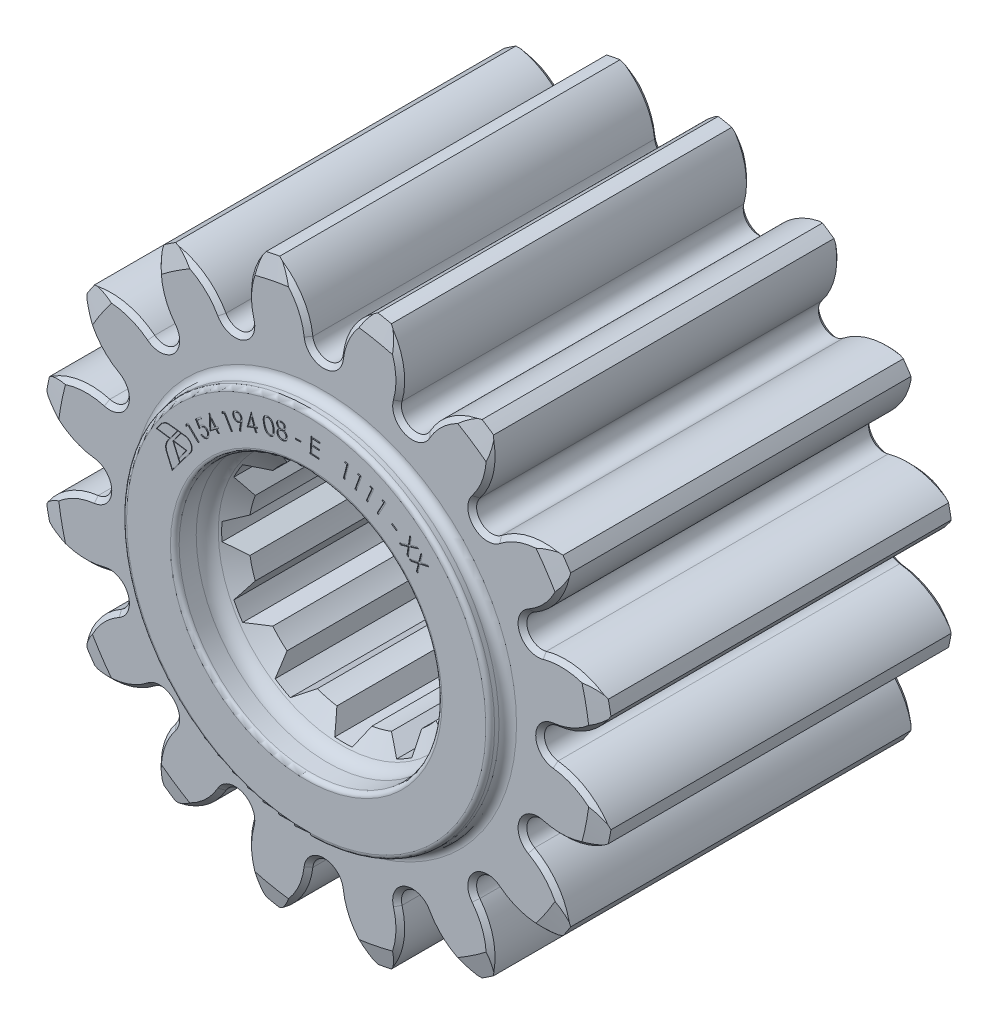
from build123d import *

# Parameters (mm, degrees)
CUT_EXTRUDE1_DEPTH = 64.806827682
CIRPATTERN1_COUNT  = 16
CUT_EXTRUDE2_DEPTH = 64.313436739
CIRPATTERN2_COUNT  = 12
CHAMFER1_SIZE      = 0.5
CHAMFER2_SIZE      = 0.5
PARTNO_START       = -0.1
PARTNO_DEPTH       = 0.1


# Read off the part's stored shape, not the designer's step: PARTNO
with BuildPart() as part:
    # Sketch2 → Revolve1 (revolve)
    with BuildSketch(Plane(origin=(0, 0, 0), x_dir=(0, 0, -1), z_dir=(1, 0, 0)), mode=Mode.PRIVATE) as revolve1_sk:
        with BuildLine():
            Line((0, 15.5), (0, 20.5))
            ThreePointArc((0, 20.5), (-0.146446609, 20.853553391), (-0.5, 21))
            Line((-0.5, 21), (-1, 21))
            ThreePointArc((-1, 21), (-1.707106781, 21.292893219), (-2, 22))
            Line((-2, 22), (-2, 30.5))
            Line((-2, 30.5), (-2.582789494, 32.675))
            Line((-2.582789494, 32.675), (-41.417210506, 32.675))
            Line((-41.417210506, 32.675), (-42, 30.5))
            Line((-42, 30.5), (-42, 22))
            ThreePointArc((-42, 22), (-42.292893219, 21.292893219), (-43, 21))
            Line((-43, 21), (-43.5, 21))
            ThreePointArc((-43.5, 21), (-43.853553391, 20.853553391), (-44, 20.5))
            Line((-44, 20.5), (-44, 15.5))
            ThreePointArc((-44, 15.5), (-43.853553391, 15.146446609), (-43.5, 15))
            Line((-43.5, 15), (-41.554291411, 15))
            ThreePointArc((-41.554291411, 15), (-40.621648935, 14.76923091), (-39.904231515, 14.130178011))
            Line((-39.904231515, 14.130178011), (-38.5, 12.08))
            Line((-38.5, 12.08), (-5.5, 12.08))
            Line((-5.5, 12.08), (-4.095768485, 14.130178011))
            ThreePointArc((-4.095768485, 14.130178011), (-3.378351065, 14.76923091), (-2.445708589, 15))
            Line((-2.445708589, 15), (-0.5, 15))
            ThreePointArc((-0.5, 15), (-0.146446609, 15.146446609), (0, 15.5))
        make_face()
    revolve(revolve1_sk.sketch.rotate(Axis((0, 0, 0), (0, 0, 1)), 90), axis=Axis((0, 0, 0), (0, 0, 1)))

    # Sketch3 → Cut-Extrude1 (cut, through all)
    with BuildSketch(Plane.XY):
        with BuildLine():
            ThreePointArc((5.6, 32.191545862), (0, 32.675), (-5.6, 32.191545862))
            ThreePointArc((-5.6, 32.191545862), (-2.972830161, 29.666253516), (-1.738267746, 26.237700112))
            ThreePointArc((-1.738267746, 26.237700112), (0, 24.69), (1.738267746, 26.237700112))
            ThreePointArc((1.738267746, 26.237700112), (2.972830161, 29.666253516), (5.6, 32.191545862))
        make_face()
    cut_extrude1 = extrude(amount=CUT_EXTRUDE1_DEPTH, mode=Mode.SUBTRACT)

    # CirPattern1: Cut-Extrude1 ×16 about axis
    cirpattern1_axis = Axis((0, 0, 0), (0, 0, 1))
    for i in range(1, CIRPATTERN1_COUNT):
        add(cut_extrude1.rotate(cirpattern1_axis, i * 360 / CIRPATTERN1_COUNT), mode=Mode.SUBTRACT)

    # Sketch4 → Cut-Extrude2 (cut, through all)
    with BuildSketch(Plane.XY):
        with BuildLine():
            Line((-1, 13.863982112), (-2, 11.9132867))
            ThreePointArc((-2, 11.9132867), (0, 12.08), (2, 11.9132867))
            Line((2, 11.9132867), (1, 13.863982112))
            ThreePointArc((1, 13.863982112), (0, 13.9), (-1, 13.863982112))
        make_face()
    cut_extrude2 = extrude(amount=CUT_EXTRUDE2_DEPTH, mode=Mode.SUBTRACT)

    # CirPattern2: Cut-Extrude2 ×12 about axis
    cirpattern2_axis = Axis((0, 0, 0), (0, 0, 1))
    for i in range(1, CIRPATTERN2_COUNT):
        add(cut_extrude2.rotate(cirpattern2_axis, i * 360 / CIRPATTERN2_COUNT), mode=Mode.SUBTRACT)

    # Chamfer1
    chamfer1_edges = [part.edges().sort_by_distance(p)[0] for p in [
        (28.390973825, -2.300498522, 2),
        (24.69, 0, 2),
        (28.390973825, 2.300498522, 2),
        (25.349476955, -12.99013881, 2),
        (22.810585658, -9.448453945, 2),
        (27.110202295, -8.739371813, 2),
        (18.448752011, -21.702148221, 2),
        (17.458466427, -17.458466427, 2),
        (21.702148221, -18.448752011, 2),
        (8.739371813, -27.110202295, 2),
        (9.448453945, -22.810585658, 2),
        (12.99013881, -25.349476955, 2),
        (-2.300498522, -28.390973825, 2),
        (0, -24.69, 2),
        (2.300498522, -28.390973825, 2),
        (-12.99013881, -25.349476955, 2),
        (-9.448453945, -22.810585658, 2),
        (-8.739371813, -27.110202295, 2),
        (-21.702148221, -18.448752011, 2),
        (-17.458466427, -17.458466427, 2),
        (-18.448752011, -21.702148221, 2),
        (-27.110202295, -8.739371813, 2),
        (-22.810585658, -9.448453945, 2),
        (-25.349476955, -12.99013881, 2),
        (-28.390973825, 2.300498522, 2),
        (-24.69, 0, 2),
        (-28.390973825, -2.300498522, 2),
        (-25.349476955, 12.99013881, 2),
        (-22.810585658, 9.448453945, 2),
        (-27.110202295, 8.739371813, 2),
        (-18.448752011, 21.702148221, 2),
        (-17.458466427, 17.458466427, 2),
        (-21.702148221, 18.448752011, 2),
        (-8.739371813, 27.110202295, 2),
        (-9.448453945, 22.810585658, 2),
        (-12.99013881, 25.349476955, 2),
        (-2.300498522, 28.390973825, 2),
        (0, 24.69, 2),
        (2.300498522, 28.390973825, 2),
        (8.739371813, 27.110202295, 2),
        (9.448453945, 22.810585658, 2),
        (12.99013881, 25.349476955, 2),
        (25.349476955, 12.99013881, 2),
        (22.810585658, 9.448453945, 2),
        (27.110202295, 8.739371813, 2),
        (18.448752011, 21.702148221, 2),
        (17.458466427, 17.458466427, 2),
        (21.702148221, 18.448752011, 2),
    ]]
    chamfer(chamfer1_edges, length=CHAMFER1_SIZE)

    # Chamfer2
    chamfer2_edges = [part.edges().sort_by_distance(p)[0] for p in [
        (-27.110202295, 8.739371813, 42),
        (-22.810585658, 9.448453945, 42),
        (-25.349476955, 12.99013881, 42),
        (-28.390973825, -2.300498522, 42),
        (-24.69, 0, 42),
        (-28.390973825, 2.300498522, 42),
        (-25.349476955, -12.99013881, 42),
        (-22.810585658, -9.448453945, 42),
        (-27.110202295, -8.739371813, 42),
        (-18.448752011, -21.702148221, 42),
        (-17.458466427, -17.458466427, 42),
        (-21.702148221, -18.448752011, 42),
        (-8.739371813, -27.110202295, 42),
        (-9.448453945, -22.810585658, 42),
        (-12.99013881, -25.349476955, 42),
        (2.300498522, -28.390973825, 42),
        (0, -24.69, 42),
        (-2.300498522, -28.390973825, 42),
        (12.99013881, -25.349476955, 42),
        (9.448453945, -22.810585658, 42),
        (8.739371813, -27.110202295, 42),
        (21.702148221, -18.448752011, 42),
        (17.458466427, -17.458466427, 42),
        (18.448752011, -21.702148221, 42),
        (27.110202295, -8.739371813, 42),
        (22.810585658, -9.448453945, 42),
        (25.349476955, -12.99013881, 42),
        (28.390973825, -2.300498522, 42),
        (24.69, 0, 42),
        (28.390973825, 2.300498522, 42),
        (27.110202295, 8.739371813, 42),
        (22.810585658, 9.448453945, 42),
        (25.349476955, 12.99013881, 42),
        (21.702148221, 18.448752011, 42),
        (17.458466427, 17.458466427, 42),
        (18.448752011, 21.702148221, 42),
        (12.99013881, 25.349476955, 42),
        (9.448453945, 22.810585658, 42),
        (8.739371813, 27.110202295, 42),
        (2.300498522, 28.390973825, 42),
        (0, 24.69, 42),
        (-2.300498522, 28.390973825, 42),
        (-8.739371813, 27.110202295, 42),
        (-9.448453945, 22.810585658, 42),
        (-12.99013881, 25.349476955, 42),
        (-18.448752011, 21.702148221, 42),
        (-17.458466427, 17.458466427, 42),
        (-21.702148221, 18.448752011, 42),
    ]]
    chamfer(chamfer2_edges, length=CHAMFER2_SIZE)

    # PARTNO outline → PARTNO (cut)
    # profile 1 of 18: a face of its own
    with BuildSketch(Plane.XY.offset(44).offset(PARTNO_START)):
        with BuildLine():
            add(Edge.make_bspline(
                [(-12.175499446, 13.4081082), (-12.164531659, 13.424485291), (-12.143365436, 13.456090678), (-12.109222678, 13.499531103), (-12.07480998, 13.538175219), (-12.050094569, 13.560589529), (-12.038119639, 13.571449546)],
                knots=[0, 0, 0, 0, 0.27607696, 0.532788087, 0.773629907, 1, 1, 1, 1], degree=3))
            Line((-12.175499446, 13.4081082), (-12.426821562, 13.836834161))
            Line((-12.426821562, 13.836834161), (-11.942927331, 14.25293993))
            Line((-11.942927331, 14.25293993), (-12.053985023, 14.382026469))
            Line((-12.053985023, 14.382026469), (-12.642446562, 13.876137046))
            Line((-12.642446562, 13.876137046), (-12.188119639, 13.093685123))
            add(Edge.make_bspline(
                [(-11.95951387, 13.416762046), (-11.969626116, 13.407647851), (-11.990290334, 13.389023137), (-12.019601961, 13.35750144), (-12.048736289, 13.322601327), (-12.077528564, 13.283900803), (-12.106062359, 13.241752964), (-12.133768258, 13.195600655), (-12.161479939, 13.146080802), (-12.179104348, 13.111416639), (-12.188119639, 13.093685123)],
                knots=[0, 0, 0, 0, 0.102501639, 0.209460487, 0.323872897, 0.444828954, 0.572641747, 0.70710504, 0.850177497, 1, 1, 1, 1], degree=3))
            add(Edge.make_bspline(
                [(-11.3746581, 13.381786084), (-11.384553522, 13.392800867), (-11.403954406, 13.41439636), (-11.435890602, 13.442806792), (-11.46880677, 13.467640505), (-11.503244222, 13.488326645), (-11.5390419, 13.504945314), (-11.576121481, 13.517718841), (-11.614573659, 13.526391505), (-11.654091781, 13.530973267), (-11.693963788, 13.531817492), (-11.733637699, 13.528184932), (-11.772618221, 13.520101113), (-11.811294649, 13.50825616), (-11.849154475, 13.491349293), (-11.886716284, 13.470649437), (-11.924230598, 13.446266263), (-11.947566805, 13.426752298), (-11.95951387, 13.416762046)],
                knots=[0, 0, 0, 0, 0.067271607, 0.131892169, 0.193967423, 0.254506049, 0.314157769, 0.373084275, 0.432472619, 0.492998914, 0.553663182, 0.613474867, 0.673701959, 0.734366227, 0.79700651, 0.861811637, 0.929253914, 1, 1, 1, 1], degree=3))
            add(Edge.make_bspline(
                [(-11.394850408, 12.745007238), (-11.38402797, 12.754740572), (-11.362734943, 12.7738908), (-11.335329745, 12.806535767), (-11.311288793, 12.840788819), (-11.291373417, 12.877455169), (-11.27547415, 12.916159536), (-11.263576027, 12.957031937), (-11.255130136, 12.999970218), (-11.251458164, 13.044808907), (-11.251313795, 13.090052599), (-11.255526585, 13.134926985), (-11.264890428, 13.178642215), (-11.277512932, 13.221732372), (-11.295724881, 13.263353397), (-11.317232333, 13.30436714), (-11.343688966, 13.344153912), (-11.364217036, 13.369098616), (-11.3746581, 13.381786084)],
                knots=[0, 0, 0, 0, 0.061469935, 0.120941422, 0.179722879, 0.238162895, 0.296953138, 0.35628552, 0.417875061, 0.481639889, 0.546175553, 0.608975351, 0.671760755, 0.734937707, 0.798459095, 0.863473133, 0.930559195, 1, 1, 1, 1], degree=3))
            add(Edge.make_bspline(
                [(-11.881989831, 12.7377957), (-11.868366538, 12.727642623), (-11.842169364, 12.708118568), (-11.800982291, 12.684589301), (-11.760568147, 12.666364973), (-11.719788553, 12.655148588), (-11.678825841, 12.649263318), (-11.637071452, 12.64875956), (-11.594203631, 12.652590529), (-11.550979514, 12.662150569), (-11.508362086, 12.67596147), (-11.467760342, 12.694516183), (-11.429478455, 12.717170045), (-11.406422969, 12.735704154), (-11.394850408, 12.745007238)],
                knots=[0, 0, 0, 0, 0.095842602, 0.184302379, 0.267258033, 0.345462177, 0.422234206, 0.500282163, 0.580701207, 0.66468295, 0.749659434, 0.833168316, 0.916259852, 1, 1, 1, 1], degree=3))
            Line((-11.881989831, 12.7377957), (-12.0215331, 12.617723584))
            add(Edge.make_bspline(
                [(-11.294249446, 12.611593776), (-11.308015613, 12.60030415), (-11.335114379, 12.578080463), (-11.378180397, 12.549227207), (-11.422365142, 12.524736928), (-11.46791536, 12.505451613), (-11.514372494, 12.489912706), (-11.56203899, 12.47969671), (-11.610765894, 12.473316127), (-11.660144878, 12.472132162), (-11.70953756, 12.474756242), (-11.757980378, 12.482616446), (-11.80536022, 12.493975149), (-11.851333202, 12.509985941), (-11.896076831, 12.530251338), (-11.939220379, 12.555458405), (-11.981743929, 12.584090228), (-12.008148186, 12.606409461), (-12.0215331, 12.617723584)],
                knots=[0, 0, 0, 0, 0.06687598, 0.131645697, 0.1945164, 0.256437175, 0.317287692, 0.378334044, 0.439346965, 0.501707715, 0.563696002, 0.624962547, 0.685875062, 0.746586269, 0.807632621, 0.87015838, 0.934180351, 1, 1, 1, 1], degree=3))
            add(Edge.make_bspline(
                [(-11.230427331, 13.496088969), (-11.221168738, 13.484889145), (-11.202748048, 13.462606229), (-11.177567728, 13.427766929), (-11.155059163, 13.391679562), (-11.134860061, 13.354809615), (-11.11760146, 13.316770655), (-11.102603386, 13.277936148), (-11.090468934, 13.238014346), (-11.080764991, 13.197306693), (-11.073500219, 13.156501978), (-11.06923583, 13.115773274), (-11.067301295, 13.075550716), (-11.068420398, 13.035662462), (-11.072306969, 12.996356489), (-11.079405293, 12.957508743), (-11.088545739, 12.918982608), (-11.101015474, 12.881125747), (-11.115609155, 12.843871127), (-11.133567616, 12.807782968), (-11.153516813, 12.77243804), (-11.176711882, 12.73840892), (-11.201581197, 12.704749423), (-11.230139653, 12.672779642), (-11.260605752, 12.641122845), (-11.282923751, 12.621534339), (-11.294249446, 12.611593776)],
                knots=[0, 0, 0, 0, 0.043859955, 0.08726278, 0.129646602, 0.17218545, 0.214075621, 0.255651909, 0.297774004, 0.339928904, 0.381924227, 0.422794725, 0.463473111, 0.503400186, 0.543150463, 0.582581509, 0.622534954, 0.662580555, 0.702804929, 0.743210542, 0.784164706, 0.825223212, 0.867457675, 0.91039697, 0.954529229, 1, 1, 1, 1], degree=3))
            add(Edge.make_bspline(
                [(-12.038119639, 13.571449546), (-12.022605544, 13.584138957), (-11.99221767, 13.60899405), (-11.943410516, 13.640438907), (-11.893647586, 13.666592255), (-11.842437162, 13.687040938), (-11.789797306, 13.701420381), (-11.735928641, 13.710598064), (-11.680693661, 13.71364068), (-11.624752139, 13.711651743), (-11.56913162, 13.703535979), (-11.514646454, 13.690760441), (-11.462232145, 13.671839235), (-11.411776104, 13.64747217), (-11.363241479, 13.617721601), (-11.316642365, 13.58246986), (-11.271636338, 13.542137783), (-11.244331163, 13.511625742), (-11.230427331, 13.496088969)],
                knots=[0, 0, 0, 0, 0.066081998, 0.12943659, 0.191160583, 0.251322211, 0.310969337, 0.370880829, 0.431261617, 0.493168766, 0.555249669, 0.616420898, 0.677505949, 0.73869517, 0.800992266, 0.864995084, 0.931255313, 1, 1, 1, 1], degree=3))
        make_face()
    # profile 2 of 18: a face of its own
    with BuildSketch(Plane.XY.offset(44).offset(PARTNO_START)):
        with BuildLine():
            add(Edge.make_bspline(
                [(-7.491836444, 16.105218555), (-7.504171194, 16.094200651), (-7.528362243, 16.072592213), (-7.566592929, 16.044328881), (-7.604911365, 16.019711208), (-7.631376735, 16.006440581), (-7.644360482, 15.999930094)],
                knots=[0, 0, 0, 0, 0.266591276, 0.522841778, 0.765909118, 1, 1, 1, 1], degree=3))
            Line((-7.491836444, 16.105218555), (-7.621644136, 15.237309901))
            Line((-7.621644136, 15.237309901), (-7.448206636, 15.213151248))
            Line((-7.448206636, 15.213151248), (-7.296764328, 16.175891632))
            add(Edge.make_bspline(
                [(-7.332461444, 16.736228171), (-7.3251544, 16.719045814), (-7.310282301, 16.684074388), (-7.293920496, 16.628205128), (-7.282112794, 16.568821551), (-7.275970476, 16.516880093), (-7.273005407, 16.472921478), (-7.272382667, 16.437309006), (-7.2731001, 16.399422235), (-7.275439863, 16.359277597), (-7.278588056, 16.316701221), (-7.283313801, 16.271735045), (-7.289520246, 16.224514434), (-7.294312123, 16.192351012), (-7.296764328, 16.175891632)],
                knots=[0, 0, 0, 0, 0.09822448, 0.199917286, 0.305763146, 0.416655247, 0.474989103, 0.537641114, 0.604088712, 0.674423104, 0.749300852, 0.828817357, 0.91239862, 1, 1, 1, 1], degree=3))
            add(Edge.make_bspline(
                [(-8.056860482, 17.004136825), (-8.034363535, 17.013656794), (-7.989930637, 17.032459338), (-7.919922698, 17.049558628), (-7.848907148, 17.057715125), (-7.777410563, 17.056027362), (-7.706589169, 17.045969266), (-7.638471633, 17.025454043), (-7.57329409, 16.995981533), (-7.512675712, 16.956844927), (-7.456318489, 16.911261515), (-7.407633767, 16.858234864), (-7.36479725, 16.800505567), (-7.343282909, 16.757739173), (-7.332461444, 16.736228171)],
                knots=[0, 0, 0, 0, 0.085104385, 0.168086566, 0.250367699, 0.333824155, 0.41690056, 0.499150706, 0.581149313, 0.665597345, 0.750207605, 0.833276603, 0.916140056, 1, 1, 1, 1], degree=3))
            add(Edge.make_bspline(
                [(-8.331620097, 16.268559901), (-8.341498358, 16.291772728), (-8.360907385, 16.337381809), (-8.378931654, 16.408676373), (-8.386882711, 16.480236903), (-8.385579521, 16.551692622), (-8.374283069, 16.622152019), (-8.353766672, 16.690613859), (-8.322717136, 16.756004042), (-8.283764683, 16.818404036), (-8.236747268, 16.875996109), (-8.182714163, 16.926465192), (-8.123063851, 16.970480005), (-8.079091305, 16.992835001), (-8.056860482, 17.004136825)],
                knots=[0, 0, 0, 0, 0.086415053, 0.169790233, 0.251085451, 0.33271436, 0.414099392, 0.495073182, 0.576947317, 0.661577455, 0.746811701, 0.831083747, 0.914602462, 1, 1, 1, 1], degree=3))
            add(Edge.make_bspline(
                [(-7.644360482, 15.999930094), (-7.660343733, 15.992997765), (-7.691895387, 15.979313037), (-7.740738314, 15.96461858), (-7.789780304, 15.954985921), (-7.838999447, 15.951280549), (-7.888413259, 15.951755625), (-7.938099753, 15.958033626), (-7.987925521, 15.969728787), (-8.037424417, 15.986235561), (-8.085381896, 16.007304529), (-8.130669982, 16.032645894), (-8.17273165, 16.061836182), (-8.211116026, 16.095471115), (-8.246826568, 16.132535141), (-8.278242229, 16.174478192), (-8.307636024, 16.219444699), (-8.323545353, 16.252024232), (-8.331620097, 16.268559901)],
                knots=[0, 0, 0, 0, 0.063504398, 0.125360524, 0.185634953, 0.245454837, 0.305086453, 0.365610697, 0.427718013, 0.491492731, 0.55568352, 0.618494027, 0.680522374, 0.742057604, 0.804388892, 0.867875128, 0.932940313, 1, 1, 1, 1], degree=3))
        make_face()
        with BuildLine():
            add(Edge.make_bspline(
                [(-8.172605674, 16.342478171), (-8.166928471, 16.331062909), (-8.155710084, 16.308505883), (-8.135394953, 16.27710264), (-8.112635526, 16.248404906), (-8.087129482, 16.222682406), (-8.059353065, 16.199439626), (-8.028761616, 16.179251852), (-7.995893673, 16.161442339), (-7.960793518, 16.14695185), (-7.924673679, 16.135240218), (-7.887993758, 16.127928647), (-7.851588664, 16.123110113), (-7.815321635, 16.123549779), (-7.779281413, 16.126491865), (-7.743471464, 16.13401214), (-7.707648872, 16.144637525), (-7.684535466, 16.154618087), (-7.672846059, 16.159665671)],
                knots=[0, 0, 0, 0, 0.064581688, 0.127616076, 0.189175858, 0.249919277, 0.310918794, 0.372424288, 0.435390923, 0.500110398, 0.564657593, 0.627506225, 0.689471653, 0.750395062, 0.810957957, 0.872490601, 0.935513211, 1, 1, 1, 1], degree=3))
            add(Edge.make_bspline(
                [(-7.989432597, 16.841877209), (-8.000847857, 16.836200006), (-8.023404881, 16.824981618), (-8.054808145, 16.804666491), (-8.083505801, 16.78190705), (-8.109228586, 16.756401058), (-8.132470301, 16.728624447), (-8.152662116, 16.698033733), (-8.170456029, 16.665162952), (-8.185006537, 16.630073717), (-8.196503087, 16.593889487), (-8.204593484, 16.557460912), (-8.208525992, 16.521066731), (-8.208889735, 16.484960158), (-8.205733798, 16.448911946), (-8.19827179, 16.413104011), (-8.187630556, 16.377280871), (-8.177652162, 16.35416754), (-8.172605674, 16.342478171)],
                knots=[0, 0, 0, 0, 0.064616881, 0.127685619, 0.189278948, 0.25005547, 0.311088228, 0.372627238, 0.435628187, 0.500382931, 0.564965301, 0.627975096, 0.689299384, 0.750259041, 0.81085494, 0.872421116, 0.935478069, 1, 1, 1, 1], degree=3))
            add(Edge.make_bspline(
                [(-7.488951828, 16.659785863), (-7.494629056, 16.671201077), (-7.505847493, 16.693758009), (-7.526162264, 16.72516194), (-7.548923014, 16.753857141), (-7.574424193, 16.779588955), (-7.602218846, 16.802796825), (-7.632693919, 16.82308571), (-7.665774287, 16.840365417), (-7.700740236, 16.855028311), (-7.736943246, 16.86648587), (-7.773368017, 16.874597061), (-7.80975929, 16.878485706), (-7.846012261, 16.879004639), (-7.882250141, 16.875230533), (-7.918336186, 16.867983244), (-7.954435601, 16.857245531), (-7.977630784, 16.84705977), (-7.989432597, 16.841877209)],
                knots=[0, 0, 0, 0, 0.064502633, 0.12745986, 0.188944286, 0.249613349, 0.310538195, 0.3719684, 0.434571765, 0.499212016, 0.563680199, 0.626578587, 0.687794448, 0.748646323, 0.809798644, 0.871852521, 0.934797984, 1, 1, 1, 1], degree=3))
            add(Edge.make_bspline(
                [(-7.672846059, 16.159665671), (-7.661278556, 16.165291616), (-7.638455521, 16.176391776), (-7.607197328, 16.197414048), (-7.578063099, 16.219849227), (-7.552314701, 16.245505292), (-7.529157671, 16.273400169), (-7.508406282, 16.303649475), (-7.491209741, 16.336865308), (-7.47651501, 16.371810022), (-7.465066496, 16.408019367), (-7.456925165, 16.444557048), (-7.453051179, 16.481079855), (-7.452662889, 16.517303298), (-7.45582503, 16.553352245), (-7.463285347, 16.589159979), (-7.473927041, 16.624983174), (-7.483905372, 16.648096497), (-7.488951828, 16.659785863)],
                knots=[0, 0, 0, 0, 0.065027298, 0.128300832, 0.19024737, 0.250901956, 0.311812263, 0.373567331, 0.436155757, 0.500780583, 0.565233381, 0.628116759, 0.689922744, 0.750760098, 0.811234422, 0.872677078, 0.93560752, 1, 1, 1, 1], degree=3))
        make_face(mode=Mode.SUBTRACT)
    # profile 3 of 18: a face of its own
    with BuildSketch(Plane.XY.offset(44).offset(PARTNO_START)):
        with BuildLine():
            add(Edge.make_bspline(
                [(-4.020223341, 16.466762631), (-4.034001218, 16.463522551), (-4.061372194, 16.457085845), (-4.102783099, 16.451665523), (-4.143846106, 16.448401444), (-4.184740248, 16.449329521), (-4.22550196, 16.453201032), (-4.26594487, 16.460606154), (-4.306206741, 16.470519083), (-4.345805329, 16.484386947), (-4.384955721, 16.501310569), (-4.423029319, 16.521877846), (-4.460121779, 16.545777063), (-4.495643256, 16.573500323), (-4.531013358, 16.603711255), (-4.564706836, 16.63801089), (-4.597107037, 16.675854236), (-4.629377411, 16.716616973), (-4.659499893, 16.762592802), (-4.689392021, 16.813108254), (-4.717145706, 16.869495105), (-4.744173612, 16.931028086), (-4.770595377, 16.997673732), (-4.795248324, 17.069970364), (-4.819140966, 17.147512089), (-4.833504389, 17.201326868), (-4.840896418, 17.229022247)],
                knots=[0, 0, 0, 0, 0.033690627, 0.066929421, 0.099359523, 0.131713722, 0.164215766, 0.196785818, 0.229557801, 0.262874172, 0.296592761, 0.331047063, 0.365826888, 0.40155632, 0.438290054, 0.476549361, 0.515922393, 0.556923803, 0.600275408, 0.646722673, 0.696652931, 0.749845511, 0.806780522, 0.867347248, 0.931731242, 1, 1, 1, 1], degree=3))
            add(Edge.make_bspline(
                [(-3.652795456, 17.536233785), (-3.646111585, 17.509596723), (-3.633064942, 17.457602268), (-3.61722928, 17.380848649), (-3.605073459, 17.307693095), (-3.595584396, 17.238116444), (-3.590787557, 17.172005129), (-3.588711493, 17.109437197), (-3.590402564, 17.05041148), (-3.595920215, 16.994805691), (-3.604144882, 16.942167749), (-3.615403016, 16.892350827), (-3.629040317, 16.844834253), (-3.645545014, 16.799878128), (-3.664846294, 16.757412413), (-3.686293942, 16.71737817), (-3.710715949, 16.67991511), (-3.737584774, 16.6450351), (-3.76702398, 16.613117147), (-3.797455346, 16.583112859), (-3.830606273, 16.557033945), (-3.864832773, 16.532963866), (-3.901037475, 16.51198637), (-3.939121727, 16.494066794), (-3.978711339, 16.478183818), (-4.006315846, 16.470588997), (-4.020223341, 16.466762631)],
                knots=[0, 0, 0, 0, 0.064916426, 0.126714206, 0.185196305, 0.240210059, 0.292641364, 0.341816635, 0.38815185, 0.432115171, 0.47382931, 0.514016592, 0.552772167, 0.590617157, 0.627112294, 0.662963562, 0.697875911, 0.732714184, 0.766906902, 0.800464501, 0.833611821, 0.866479091, 0.899325476, 0.932369124, 0.965926724, 1, 1, 1, 1], degree=3))
            add(Edge.make_bspline(
                [(-4.492939687, 18.294527055), (-4.478920376, 18.297857585), (-4.45118763, 18.304445981), (-4.409106166, 18.310668164), (-4.367136312, 18.312938471), (-4.325413504, 18.31290221), (-4.283957098, 18.308673603), (-4.242664044, 18.301614161), (-4.201688613, 18.290520714), (-4.160783544, 18.277048799), (-4.120649146, 18.259587124), (-4.081412978, 18.23862477), (-4.042992549, 18.2144115), (-4.005786676, 18.186503949), (-3.96967833, 18.155009849), (-3.934630264, 18.119941061), (-3.900877379, 18.08114043), (-3.867384986, 18.039202893), (-3.835164044, 17.99301395), (-3.805052867, 17.94179138), (-3.775711856, 17.886183037), (-3.748035002, 17.825629636), (-3.722203843, 17.760023042), (-3.697361648, 17.689809256), (-3.673881032, 17.614762368), (-3.659941853, 17.562848966), (-3.652795456, 17.536233785)],
                knots=[0, 0, 0, 0, 0.034020952, 0.067299627, 0.100286484, 0.133214668, 0.165724214, 0.198577682, 0.232038654, 0.265879135, 0.300206589, 0.335254114, 0.370849113, 0.407352666, 0.444976857, 0.483915462, 0.524343359, 0.566368959, 0.610621831, 0.657209209, 0.706600465, 0.759058024, 0.814351122, 0.873065504, 0.93492269, 1, 1, 1, 1], degree=3))
            add(Edge.make_bspline(
                [(-4.840896418, 17.229022247), (-4.847926796, 17.256984663), (-4.861579327, 17.311285831), (-4.878498006, 17.391027677), (-4.891969296, 17.466415788), (-4.90178587, 17.53749862), (-4.908097866, 17.604272128), (-4.910538248, 17.666853454), (-4.910298839, 17.725162922), (-4.905305619, 17.779449446), (-4.897806209, 17.830398086), (-4.88726849, 17.878776144), (-4.874359882, 17.92492254), (-4.858971803, 17.968777949), (-4.840375407, 18.009999388), (-4.819582951, 18.049028874), (-4.79594781, 18.085595584), (-4.770075359, 18.119976286), (-4.741575972, 18.151418202), (-4.711606918, 18.180661626), (-4.679438556, 18.206464083), (-4.645634154, 18.229831586), (-4.61002662, 18.250269697), (-4.57269102, 18.268070227), (-4.533582849, 18.282932136), (-4.506583127, 18.290634774), (-4.492939687, 18.294527055)],
                knots=[0, 0, 0, 0, 0.06859393, 0.133204887, 0.193900276, 0.250761428, 0.303887285, 0.35339919, 0.399728561, 0.442498763, 0.482981325, 0.522187329, 0.560210596, 0.596931946, 0.632645152, 0.667700872, 0.702047275, 0.736134376, 0.769951723, 0.802916827, 0.835652918, 0.867936241, 0.900603565, 0.933220785, 0.966255274, 1, 1, 1, 1], degree=3))
        make_face()
        with BuildLine():
            add(Edge.make_bspline(
                [(-4.443901225, 18.130825131), (-4.462802384, 18.124872607), (-4.500534346, 18.112989714), (-4.55280499, 18.083055899), (-4.600814326, 18.04454803), (-4.635984896, 18.005133466), (-4.661960993, 17.970255404), (-4.678673084, 17.941092355), (-4.69399512, 17.910491043), (-4.706879625, 17.877728725), (-4.718226502, 17.843259691), (-4.726603246, 17.806623145), (-4.733603536, 17.768271155), (-4.738300058, 17.727572167), (-4.740473922, 17.683853153), (-4.739576087, 17.636414393), (-4.73591902, 17.584909478), (-4.729181609, 17.529381323), (-4.72032699, 17.469662157), (-4.707724831, 17.406035658), (-4.69313471, 17.338155761), (-4.681428967, 17.29184817), (-4.67539161, 17.267964555)],
                knots=[0, 0, 0, 0, 0.059376885, 0.118532753, 0.179651138, 0.243544909, 0.27661737, 0.310114695, 0.344343321, 0.379338263, 0.415758575, 0.45323712, 0.492115361, 0.532821302, 0.576198072, 0.623497477, 0.675249714, 0.731225604, 0.791474123, 0.856543284, 0.926010727, 1, 1, 1, 1], degree=3))
            add(Edge.make_bspline(
                [(-3.815055071, 17.490440516), (-3.820654676, 17.511762756), (-3.831623985, 17.553531825), (-3.850551959, 17.613901232), (-3.869963804, 17.671078686), (-3.890308285, 17.724872401), (-3.912436616, 17.774888807), (-3.935100393, 17.821661803), (-3.958905017, 17.865001469), (-3.983663044, 17.904993725), (-4.009479173, 17.941578497), (-4.035644923, 17.975209342), (-4.062749841, 18.005437851), (-4.09015716, 18.03287396), (-4.118682734, 18.056525204), (-4.147596326, 18.077356778), (-4.177367024, 18.094718902), (-4.217066856, 18.113594174), (-4.267134508, 18.130648599), (-4.327293983, 18.14121929), (-4.386734409, 18.142839268), (-4.42487457, 18.134823759), (-4.443901225, 18.130825131)],
                knots=[0, 0, 0, 0, 0.066271714, 0.129822558, 0.190160679, 0.247809349, 0.302662994, 0.354541134, 0.404030912, 0.451260566, 0.495874074, 0.538597682, 0.579290911, 0.617875766, 0.655075246, 0.690571829, 0.724907155, 0.758527644, 0.822635975, 0.883175034, 0.941720532, 1, 1, 1, 1], degree=3))
            add(Edge.make_bspline(
                [(-3.764574302, 17.026378016), (-3.763445327, 17.043557627), (-3.7611497, 17.078490181), (-3.76081587, 17.131943538), (-3.763696066, 17.187248403), (-3.767931718, 17.244470736), (-3.776445218, 17.303417754), (-3.786179117, 17.364246796), (-3.799396448, 17.426847648), (-3.809764776, 17.468955544), (-3.815055071, 17.490440516)],
                knots=[0, 0, 0, 0, 0.110129837, 0.223935019, 0.341705351, 0.464374203, 0.590847291, 0.722569032, 0.858444681, 1, 1, 1, 1], degree=3))
            add(Edge.make_bspline(
                [(-4.054478148, 16.625777055), (-4.035711907, 16.631628929), (-3.998159002, 16.643339047), (-3.946116235, 16.672599785), (-3.898722239, 16.710775357), (-3.863476648, 16.749280519), (-3.838414969, 16.784268238), (-3.821285567, 16.812924043), (-3.806721338, 16.843722759), (-3.793414124, 16.876190288), (-3.783273531, 16.911087334), (-3.774412826, 16.947721809), (-3.768476105, 16.986468257), (-3.765891662, 17.012903342), (-3.764574302, 17.026378016)],
                knots=[0, 0, 0, 0, 0.111153571, 0.222428112, 0.335821258, 0.45489986, 0.516896447, 0.579507338, 0.643785414, 0.709808076, 0.778113588, 0.849484739, 0.923278319, 1, 1, 1, 1], degree=3))
            add(Edge.make_bspline(
                [(-4.67539161, 17.267964555), (-4.669165497, 17.244246471), (-4.657078302, 17.198200876), (-4.637163266, 17.132005875), (-4.617099372, 17.070472496), (-4.596208928, 17.013975333), (-4.575051151, 16.962313437), (-4.553340218, 16.91565952), (-4.531606683, 16.873656919), (-4.508643665, 16.836542881), (-4.484887914, 16.803285958), (-4.460304711, 16.77307369), (-4.435199958, 16.744952277), (-4.40847588, 16.720341024), (-4.381113808, 16.697924939), (-4.352825509, 16.678210646), (-4.323473186, 16.661035819), (-4.283493516, 16.642705172), (-4.233164701, 16.625641015), (-4.172404312, 16.614868311), (-4.112370418, 16.613888385), (-4.073745877, 16.621820263), (-4.054478148, 16.625777055)],
                knots=[0, 0, 0, 0, 0.073655279, 0.14299221, 0.207614511, 0.268043188, 0.32389466, 0.375261076, 0.422580225, 0.465865182, 0.506241107, 0.545260876, 0.582832283, 0.619362279, 0.654266356, 0.689020727, 0.72283212, 0.756269403, 0.821005574, 0.881847017, 0.941059762, 1, 1, 1, 1], degree=3))
        make_face(mode=Mode.SUBTRACT)
    # profile 4 of 18: a face of its own
    with BuildSketch(Plane.XY.offset(44).offset(PARTNO_START)):
        with BuildLine():
            add(Edge.make_bspline(
                [(-2.335939336, 18.186443105), (-2.333909389, 18.166753913), (-2.329924254, 18.128100649), (-2.334090819, 18.070388052), (-2.34686095, 18.014973171), (-2.36808312, 17.961758188), (-2.397720649, 17.910842155), (-2.435849332, 17.8621757), (-2.482162851, 17.815536015), (-2.517707528, 17.787630032), (-2.536059528, 17.773221951)],
                knots=[0, 0, 0, 0, 0.122443532, 0.240377676, 0.356521103, 0.473499343, 0.593936273, 0.720240397, 0.855557883, 1, 1, 1, 1], degree=3))
            add(Edge.make_bspline(
                [(-2.910698951, 18.582356566), (-2.887890259, 18.584709873), (-2.84280656, 18.589361421), (-2.775023439, 18.586674781), (-2.708760873, 18.575445478), (-2.644612071, 18.555894801), (-2.583992291, 18.529126071), (-2.528285133, 18.495394344), (-2.478251108, 18.454923196), (-2.434689052, 18.408195353), (-2.397466939, 18.357158219), (-2.368037562, 18.302922881), (-2.346801571, 18.245823757), (-2.339571676, 18.206300039), (-2.335939336, 18.186443105)],
                knots=[0, 0, 0, 0, 0.088789013, 0.175500513, 0.261967639, 0.348622807, 0.434757986, 0.518169235, 0.60031152, 0.683365546, 0.765087988, 0.844504661, 0.92187828, 1, 1, 1, 1], degree=3))
            add(Edge.make_bspline(
                [(-3.371155682, 18.045457528), (-3.372962909, 18.064796942), (-3.376603018, 18.1037503), (-3.370944931, 18.163099816), (-3.356984191, 18.222817589), (-3.334734886, 18.282285871), (-3.30433912, 18.339598643), (-3.266132835, 18.392845822), (-3.220174168, 18.440793233), (-3.167183618, 18.483121672), (-3.108704636, 18.51917969), (-3.046247304, 18.548861846), (-2.979892149, 18.570371841), (-2.933899607, 18.578338057), (-2.910698951, 18.582356566)],
                knots=[0, 0, 0, 0, 0.074256899, 0.149567904, 0.227063093, 0.308634818, 0.392036956, 0.474821935, 0.558825349, 0.645599576, 0.733871305, 0.821389617, 0.909901086, 1, 1, 1, 1], degree=3))
            add(Edge.make_bspline(
                [(-3.057093182, 17.700024836), (-3.079311132, 17.708659855), (-3.122406262, 17.725408803), (-3.181485947, 17.758002017), (-3.233169002, 17.795794954), (-3.276868373, 17.838789742), (-3.31288293, 17.885772816), (-3.340538931, 17.936303386), (-3.360985781, 17.989546162), (-3.367761809, 18.026798931), (-3.371155682, 18.045457528)],
                knots=[0, 0, 0, 0, 0.145203544, 0.281644599, 0.410031993, 0.534393431, 0.654133134, 0.769578181, 0.884589844, 1, 1, 1, 1], degree=3))
            add(Edge.make_bspline(
                [(-3.334737413, 17.172861374), (-3.337183281, 17.19712124), (-3.342003612, 17.244932719), (-3.335943269, 17.316413092), (-3.320710784, 17.385716816), (-3.298258352, 17.440949639), (-3.275499677, 17.484054923), (-3.254487605, 17.516058024), (-3.230024912, 17.547653042), (-3.202261533, 17.579033571), (-3.170787697, 17.609936952), (-3.136082929, 17.640569121), (-3.098163301, 17.671046303), (-3.071024148, 17.69019533), (-3.057093182, 17.700024836)],
                knots=[0, 0, 0, 0, 0.115576701, 0.227779204, 0.338972482, 0.45143167, 0.50965252, 0.570288325, 0.632966451, 0.699281651, 0.76910758, 0.842296019, 0.919047999, 1, 1, 1, 1], degree=3))
            add(Edge.make_bspline(
                [(-2.66117972, 16.718173874), (-2.685063278, 16.715213508), (-2.731390681, 16.709471229), (-2.799703513, 16.708276289), (-2.864336145, 16.712182195), (-2.925177913, 16.722817906), (-2.982500153, 16.738553216), (-3.035989687, 16.760638549), (-3.085999198, 16.788556205), (-3.131328486, 16.822548724), (-3.172471885, 16.860087208), (-3.209882758, 16.899181892), (-3.242129223, 16.94065744), (-3.26988036, 16.983659303), (-3.293853904, 17.028148905), (-3.311870589, 17.074929764), (-3.326478093, 17.123075659), (-3.33197231, 17.156193822), (-3.334737413, 17.172861374)],
                knots=[0, 0, 0, 0, 0.079263085, 0.153748153, 0.224810549, 0.292340783, 0.356925747, 0.420333889, 0.482584553, 0.545170795, 0.606587902, 0.665990825, 0.72327871, 0.779422673, 0.834528618, 0.889474886, 0.944375445, 1, 1, 1, 1], degree=3))
            add(Edge.make_bspline(
                [(-2.218751836, 16.975625797), (-2.230695473, 16.958215132), (-2.254345975, 16.923738954), (-2.297407553, 16.878199924), (-2.344672724, 16.837288452), (-2.398027901, 16.802658649), (-2.456262762, 16.772997079), (-2.519868985, 16.748874087), (-2.588574008, 16.729969318), (-2.63656864, 16.722172163), (-2.66117972, 16.718173874)],
                knots=[0, 0, 0, 0, 0.119592445, 0.236814077, 0.354312924, 0.473436151, 0.596612453, 0.724361885, 0.858656028, 1, 1, 1, 1], degree=3))
            add(Edge.make_bspline(
                [(-2.135819144, 17.356395028), (-2.133844448, 17.339471904), (-2.129946328, 17.306065037), (-2.129225526, 17.255944701), (-2.13339412, 17.206880719), (-2.141127147, 17.158528362), (-2.153922922, 17.111257081), (-2.170947192, 17.064759299), (-2.192587775, 17.019324915), (-2.209979737, 16.990276923), (-2.218751836, 16.975625797)],
                knots=[0, 0, 0, 0, 0.12828871, 0.253246611, 0.376782708, 0.4988368, 0.621604086, 0.74506053, 0.871414506, 1, 1, 1, 1], degree=3))
            add(Edge.make_bspline(
                [(-2.536059528, 17.773221951), (-2.52050258, 17.7678353), (-2.490222159, 17.757350593), (-2.446735094, 17.739625106), (-2.406433326, 17.720564012), (-2.369022181, 17.700365517), (-2.334822866, 17.67878251), (-2.303538029, 17.65598462), (-2.275418956, 17.631896018), (-2.250245744, 17.6064077), (-2.227967764, 17.579561854), (-2.207507334, 17.551830333), (-2.189976367, 17.522459607), (-2.174230167, 17.4919559), (-2.160954427, 17.459998117), (-2.150187607, 17.426558039), (-2.141342224, 17.392028369), (-2.137669346, 17.368332007), (-2.135819144, 17.356395028)],
                knots=[0, 0, 0, 0, 0.080508247, 0.156703207, 0.229540753, 0.298458497, 0.364508733, 0.427176381, 0.487621022, 0.545399982, 0.602150082, 0.658118443, 0.713767928, 0.76924016, 0.825898851, 0.882782753, 0.940952126, 1, 1, 1, 1], degree=3))
        make_face()
        with BuildLine():
            add(Edge.make_bspline(
                [(-2.312501836, 17.327909451), (-2.314666146, 17.340101427), (-2.318938504, 17.36416844), (-2.329501974, 17.399197029), (-2.343992421, 17.432423551), (-2.362223157, 17.464044552), (-2.384018528, 17.494087671), (-2.409426026, 17.522787387), (-2.438683541, 17.549646773), (-2.470978574, 17.57477176), (-2.505421548, 17.597187027), (-2.541404807, 17.616293479), (-2.578630914, 17.630921055), (-2.616849995, 17.642255149), (-2.656070588, 17.649994803), (-2.696454577, 17.652965938), (-2.737732903, 17.65279231), (-2.765403703, 17.649681006), (-2.779448951, 17.648101759)],
                knots=[0, 0, 0, 0, 0.059241063, 0.116942105, 0.174663224, 0.232398679, 0.29132597, 0.352057121, 0.415572664, 0.481175272, 0.547724806, 0.61206632, 0.67585232, 0.73884449, 0.802713477, 0.866789462, 0.9323845, 1, 1, 1, 1], degree=3))
            add(Edge.make_bspline(
                [(-2.682093182, 16.88620272), (-2.666419101, 16.88871105), (-2.635770474, 16.893615762), (-2.591525674, 16.905148737), (-2.550384637, 16.920461388), (-2.511923589, 16.938305522), (-2.476672634, 16.959792742), (-2.44439879, 16.984438085), (-2.415002394, 17.012247126), (-2.38919337, 17.043330289), (-2.366819415, 17.076232078), (-2.347371763, 17.109988122), (-2.331804409, 17.144621439), (-2.320211433, 17.180041077), (-2.312601177, 17.216085394), (-2.308686098, 17.252794284), (-2.3080614, 17.290278645), (-2.311014781, 17.315307292), (-2.312501836, 17.327909451)],
                knots=[0, 0, 0, 0, 0.073943496, 0.144586886, 0.212633563, 0.278277388, 0.34186759, 0.404601026, 0.467196792, 0.530017679, 0.59247045, 0.652424448, 0.711341289, 0.769082982, 0.825766413, 0.88267079, 0.940923637, 1, 1, 1, 1], degree=3))
            add(Edge.make_bspline(
                [(-3.155170105, 17.191971951), (-3.152282402, 17.175982938), (-3.146524174, 17.144100034), (-3.129297213, 17.098375131), (-3.106570719, 17.054698799), (-3.077303454, 17.014045692), (-3.042587186, 16.977395215), (-3.002708115, 16.946036063), (-2.958422514, 16.920087709), (-2.909304722, 16.900909115), (-2.856824134, 16.886963169), (-2.800923136, 16.880643317), (-2.742264623, 16.87901408), (-2.702497813, 16.883764993), (-2.682093182, 16.88620272)],
                knots=[0, 0, 0, 0, 0.077212316, 0.153965284, 0.231518215, 0.311073931, 0.391617445, 0.471064021, 0.551834865, 0.635033887, 0.721359881, 0.80958049, 0.902294406, 1, 1, 1, 1], degree=3))
            add(Edge.make_bspline(
                [(-2.779448951, 17.648101759), (-2.794410685, 17.64560691), (-2.823762583, 17.640712522), (-2.866164602, 17.628876179), (-2.906494959, 17.614401308), (-2.944074478, 17.595288911), (-2.979537084, 17.573360314), (-3.012623133, 17.547981849), (-3.04306785, 17.518852398), (-3.07072822, 17.486700406), (-3.095698529, 17.452780103), (-3.116131667, 17.417317173), (-3.132982123, 17.381428743), (-3.145682209, 17.344812252), (-3.154379468, 17.307468268), (-3.159145097, 17.269527471), (-3.15954846, 17.230805979), (-3.156645067, 17.205054195), (-3.155170105, 17.191971951)],
                knots=[0, 0, 0, 0, 0.069247455, 0.135849505, 0.200822371, 0.264667141, 0.328049819, 0.391089087, 0.454782566, 0.520176331, 0.584646101, 0.646896083, 0.706836596, 0.765529296, 0.823599717, 0.881693497, 0.939898749, 1, 1, 1, 1], degree=3))
        make_face(mode=Mode.SUBTRACT)
        with BuildLine():
            add(Edge.make_bspline(
                [(-2.515506644, 18.168414259), (-2.516982239, 18.177235102), (-2.519933429, 18.19487679), (-2.528073165, 18.220450329), (-2.538638897, 18.245165216), (-2.551491191, 18.26896308), (-2.567418961, 18.291637978), (-2.585701984, 18.313518739), (-2.606758753, 18.334588189), (-2.630453011, 18.354194699), (-2.656099209, 18.372299717), (-2.684254188, 18.387369428), (-2.714564807, 18.39854993), (-2.746675828, 18.407655867), (-2.780998777, 18.412299482), (-2.817269365, 18.414425468), (-2.855663412, 18.413934987), (-2.881753848, 18.41062446), (-2.895194144, 18.408919066)],
                knots=[0, 0, 0, 0, 0.053416326, 0.106832651, 0.159958141, 0.213984904, 0.26820727, 0.325346596, 0.384292124, 0.44603196, 0.509026302, 0.57171658, 0.636313759, 0.701863281, 0.770870874, 0.84286353, 0.919052311, 1, 1, 1, 1], degree=3))
            add(Edge.make_bspline(
                [(-2.804328759, 17.808197913), (-2.789935528, 17.810836263), (-2.761280595, 17.816088855), (-2.719993715, 17.83047452), (-2.680561663, 17.849723579), (-2.643733558, 17.874239512), (-2.609857165, 17.902726476), (-2.580801307, 17.935458002), (-2.556780718, 17.971562272), (-2.537873588, 18.01032762), (-2.523947, 18.050312129), (-2.515001598, 18.090337681), (-2.511849703, 18.129858645), (-2.514299265, 18.155684705), (-2.515506644, 18.168414259)],
                knots=[0, 0, 0, 0, 0.085895013, 0.171005102, 0.25598611, 0.343169816, 0.430362105, 0.515422345, 0.599470507, 0.684451515, 0.768226136, 0.847756637, 0.924959904, 1, 1, 1, 1], degree=3))
            add(Edge.make_bspline(
                [(-3.191588374, 18.069616182), (-3.189859575, 18.0599573), (-3.186401457, 18.040636634), (-3.177736521, 18.012504697), (-3.165786201, 17.98560553), (-3.150296841, 17.960111047), (-3.131986353, 17.935673436), (-3.110456646, 17.912383254), (-3.085802542, 17.890490088), (-3.058679617, 17.869707584), (-3.029532754, 17.851126678), (-2.999106477, 17.835760856), (-2.968433646, 17.822685282), (-2.936695704, 17.814044386), (-2.904614701, 17.807077553), (-2.871572432, 17.804580694), (-2.83800942, 17.804249917), (-2.8156126, 17.806875238), (-2.804328759, 17.808197913)],
                knots=[0, 0, 0, 0, 0.05711815, 0.11425346, 0.17097981, 0.228132275, 0.287641789, 0.348583707, 0.412539611, 0.479472654, 0.547452044, 0.613519021, 0.677876027, 0.741250659, 0.80482221, 0.868778114, 0.933888523, 1, 1, 1, 1], degree=3))
            add(Edge.make_bspline(
                [(-2.895194144, 18.408919066), (-2.907003371, 18.406915051), (-2.930196046, 18.402979276), (-2.963966851, 18.394432355), (-2.995598479, 18.382782502), (-3.025470963, 18.369064441), (-3.053322614, 18.352863715), (-3.079096021, 18.333911168), (-3.103007081, 18.312542383), (-3.124765009, 18.288919378), (-3.144054766, 18.263935165), (-3.160638065, 18.238126762), (-3.17355649, 18.211445827), (-3.183340017, 18.184213855), (-3.190291312, 18.156444975), (-3.194403608, 18.128053278), (-3.194647788, 18.098868869), (-3.192617735, 18.079458446), (-3.191588374, 18.069616182)],
                knots=[0, 0, 0, 0, 0.071674319, 0.140764427, 0.208121462, 0.273133016, 0.337287274, 0.400593059, 0.464273727, 0.528922119, 0.592517411, 0.652984562, 0.712180398, 0.769520214, 0.825872398, 0.883248299, 0.940799793, 1, 1, 1, 1], degree=3))
        make_face(mode=Mode.SUBTRACT)
    # profile 5 of 18: a face of its own
    with BuildSketch(Plane.XY.offset(44).offset(PARTNO_START)):
        Polygon((-13.741185458, 12.806908871), (-13.689622958, 12.606788679), (-13.492747958, 12.809793487), (-12.326281612, 11.679384833), (-12.202243151, 11.807750218), (-13.495271997, 13.060755025), align=None)
    # profile 6 of 18: a face of its own
    with BuildSketch(Plane.XY.offset(44).offset(PARTNO_START)):
        Polygon((-11.071787021, 15.237477023), (-10.987772597, 13.508871253), (-10.314575482, 14.033150099), (-10.059647597, 13.705746253), (-9.918662021, 13.815361638), (-10.173589905, 14.142765484), (-10.003037021, 14.275457792), (-10.108325482, 14.410674138), (-10.278878367, 14.27798183), (-11.042940867, 15.259832792), align=None)
        Polygon((-10.419863944, 14.168366446), (-10.834527405, 13.845650099), (-10.876714905, 14.755385676), align=None, mode=Mode.SUBTRACT)
    # profile 7 of 18: a face of its own
    with BuildSketch(Plane.XY.offset(44).offset(PARTNO_START)):
        Polygon((-9.597928634, 16.130164177), (-9.602255557, 15.926438215), (-9.360308441, 16.066702639), (-8.554058441, 14.675957446), (-8.401173826, 14.764298792), (-9.295044018, 16.305765139), align=None)
    # profile 8 of 18: a face of its own
    with BuildSketch(Plane.XY.offset(44).offset(PARTNO_START)):
        Polygon((-6.267892368, 17.737543128), (-6.73051256, 16.059778705), (-5.922459675, 16.349321975), (-5.781834675, 15.956293128), (-5.613084675, 16.016509475), (-5.753709675, 16.409538321), (-5.548901983, 16.483096013), (-5.606954868, 16.645355628), (-5.81176256, 16.571797936), (-6.23363756, 17.749802744), align=None)
        Polygon((-5.98051256, 16.51158159), (-6.478469291, 16.333096013), (-6.232916406, 17.216148898), align=None, mode=Mode.SUBTRACT)
    # profile 9 of 18: a face of its own
    with BuildSketch(Plane.XY.offset(44).offset(PARTNO_START)):
        Polygon((-1.247690236, 17.702048815), (-1.240478698, 17.5538517), (-0.570887352, 17.5866642), (-0.57809889, 17.734861315), align=None)
    # profile 10 of 18: a face of its own
    with BuildSketch(Plane.XY.offset(44).offset(PARTNO_START)):
        Polygon((0.561340245, 18.775011826), (0.448840245, 16.984747403), (1.467109476, 16.920564711), (1.478287361, 17.096886826), (0.638864284, 17.149891634), (0.682854669, 17.85229548), (1.522277745, 17.799290672), (1.53345563, 17.974531057), (0.694032553, 18.027535864), (0.729369092, 18.587151249), (1.576364284, 18.533785864), (1.587181592, 18.710468557), align=None)
    # profile 11 of 18: a face of its own
    with BuildSketch(Plane.XY.offset(44).offset(PARTNO_START)):
        Polygon((4.516744162, 18.234899533), (4.368547047, 18.091389917), (4.641864354, 18.02071684), (4.235854739, 16.450764917), (4.408571085, 16.406053379), (4.858571085, 18.146558187), align=None)
    # profile 12 of 18: a face of its own
    with BuildSketch(Plane.XY.offset(44).offset(PARTNO_START)):
        Polygon((6.000103852, 17.795576994), (5.839647121, 17.666129879), (6.105031736, 17.570937571), (5.559118275, 16.045697186), (5.726786544, 15.985841417), (6.332195198, 17.676586609), align=None)
    # profile 13 of 18: a face of its own
    with BuildSketch(Plane.XY.offset(44).offset(PARTNO_START)):
        Polygon((7.390511351, 17.263252993), (7.223564235, 17.144262609), (7.481376735, 17.034286647), (6.849645966, 15.554118378), (7.012626735, 15.484527032), (7.71286712, 17.125512609), align=None)
    # profile 14 of 18: a face of its own
    with BuildSketch(Plane.XY.offset(44).offset(PARTNO_START)):
        Polygon((8.783316762, 16.597515317), (8.606273493, 16.494390317), (8.853629262, 16.361337433), (8.088845608, 14.940664356), (8.244975416, 14.856649933), (9.092691762, 16.431289356), align=None)
    # profile 15 of 18: a face of its own
    with BuildSketch(Plane.XY.offset(44).offset(PARTNO_START)):
        Polygon((9.814176298, 14.787833259), (9.731604182, 14.664155375), (10.289416682, 14.29203999), (10.371988798, 14.415717875), align=None)
    # profile 16 of 18: a face of its own
    with BuildSketch(Plane.XY.offset(44).offset(PARTNO_START)):
        Polygon((11.82891082, 14.595828542), (11.666290627, 13.589818926), (10.630353127, 13.26241508), (10.78936755, 13.125395849), (11.634559858, 13.390419888), (11.496819473, 12.51710258), (11.655833897, 12.380083349), (11.827107935, 13.451357388), (12.798141589, 13.762174696), (12.64093005, 13.897391042), (11.857396397, 13.649314119), (11.987925243, 14.459169888), align=None)
    # profile 17 of 18: a face of its own
    with BuildSketch(Plane.XY.offset(44).offset(PARTNO_START)):
        Polygon((13.094612937, 13.482614809), (12.84004563, 12.491388848), (11.774540822, 12.257735002), (11.920935053, 12.106653271), (12.790286014, 12.294513848), (12.573579283, 11.433095579), (12.719973514, 11.282013848), (12.988603322, 12.338143656), (13.988122553, 12.560619617), (13.843531206, 12.709898463), (13.036199476, 12.532855194), (13.241007168, 13.331533079), align=None)
    # profile 18 of 18: a face of its own
    with BuildSketch(Plane.XY.offset(44).offset(PARTNO_START)):
        with BuildLine():
            ThreePointArc((-15.781356886, 10.218638707), (-16.0235788, 9.638335802), (-15.957422875, 9.012998844))
            Line((-15.957422875, 9.012998844), (-15.28132616, 7.448561659))
            Line((-15.28132616, 7.448561659), (-13.199168902, 10.211334177))
            ThreePointArc((-13.199168902, 10.211334177), (-13.097791936, 11.119086235), (-13.844992879, 11.644425972))
            Line((-13.844992879, 11.644425972), (-14.200316313, 11.687741849))
            Line((-14.200316313, 11.687741849), (-14.626730674, 11.750688966))
            Line((-14.626730674, 11.750688966), (-15.636607066, 11.862775817))
            ThreePointArc((-15.636607066, 11.862775817), (-16.137297287, 11.787955085), (-16.535333311, 11.475135387))
            Line((-16.535333311, 11.475135387), (-17.114577823, 10.706547514))
            Line((-17.114577823, 10.706547514), (-15.575506541, 10.491777383))
            Line((-15.575506541, 10.491777383), (-15.781356886, 10.218638707))
        make_face()
        with BuildLine():
            Line((-14.599383241, 11.68728522), (-14.301007456, 11.654168294))
            Line((-14.301007456, 11.654168294), (-15.218857613, 10.436291412))
            Line((-15.218857613, 10.436291412), (-14.448382128, 8.653468818))
            Line((-14.448382128, 8.653468818), (-15.267165743, 7.567041335))
            Line((-15.267165743, 7.567041335), (-15.90171824, 9.035348308))
            ThreePointArc((-15.90171824, 9.035348308), (-15.964096674, 9.630429924), (-15.733440913, 10.182526943))
            Line((-15.733440913, 10.182526943), (-14.599383241, 11.68728522))
        make_face(mode=Mode.SUBTRACT)
        Polygon((-14.561895557, 9.067376217), (-15.149840647, 10.427837139), (-13.6932463, 10.219969417), align=None, mode=Mode.SUBTRACT)
        with BuildLine():
            Line((-14.406840265, 8.708589879), (-14.534514112, 9.004017602))
            Line((-14.534514112, 9.004017602), (-13.584169195, 10.265011125))
            Line((-13.584169195, 10.265011125), (-15.108599229, 10.482559546))
            Line((-15.108599229, 10.482559546), (-14.242036906, 11.632383634))
            Line((-14.242036906, 11.632383634), (-13.850946541, 11.584707572))
            ThreePointArc((-13.850946541, 11.584707572), (-13.152755373, 11.095014386), (-13.247084875, 10.247445942))
            Line((-13.247084875, 10.247445942), (-14.406840265, 8.708589879))
        make_face(mode=Mode.SUBTRACT)
        with BuildLine():
            Line((-14.668715286, 11.69498043), (-15.534194258, 10.546593819))
            Line((-15.534194258, 10.546593819), (-17.005283547, 10.751877384))
            Line((-17.005283547, 10.751877384), (-16.487417339, 11.439023623))
            ThreePointArc((-16.487417339, 11.439023623), (-16.113534167, 11.7328614), (-15.643225862, 11.803142005))
            Line((-15.643225862, 11.803142005), (-14.668715286, 11.69498043))
        make_face(mode=Mode.SUBTRACT)
    extrude(amount=PARTNO_DEPTH, mode=Mode.SUBTRACT)


solid = part.part
